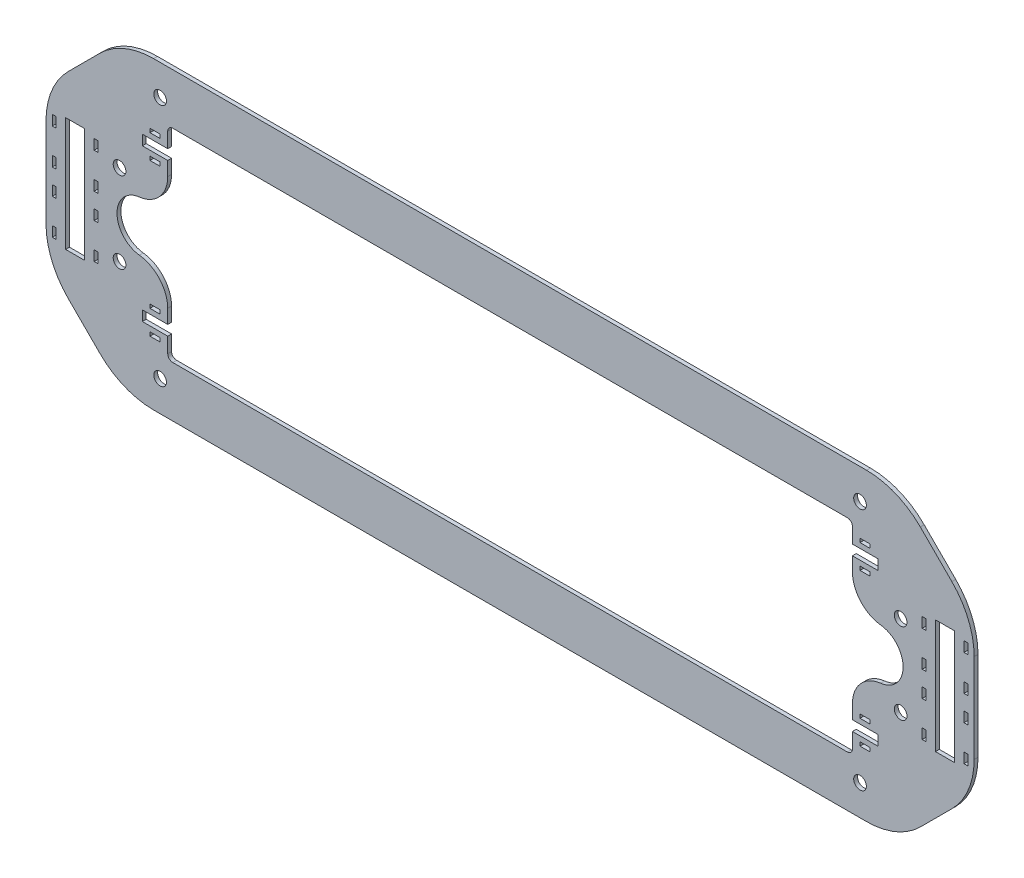
from build123d import *

# Parameters (mm, degrees)
BASE_FLANGE1_DEPTH = 1.51892
SKETCH7_R          = 2.5
SKETCH7_W          = 1.5
SKETCH7_H          = 4
SKETCH7_W_2        = 4
SKETCH7_H_2        = 1.5
CUT_EXTRUDE1_DEPTH = 10
SKETCH8_W          = 7.5
SKETCH8_H          = 45
CUT_EXTRUDE2_DEPTH = 1.51892
CUT_EXTRUDE3_START = -10
CUT_EXTRUDE3_DEPTH = 10
FILLET1_R          = 30


# Sheet-metal steps are written as plain solids
with BuildPart() as part:
    # Sketch2 → Base-Flange1 (new body)
    with BuildSketch(Plane.XY):
        with BuildLine():
            Line((183, -35), (183, 35))
            ThreePointArc((183, 35), (175.67766953, 52.67766953), (158, 60))
            Line((158, 60), (-158, 60))
            ThreePointArc((-158, 60), (-175.67766953, 52.67766953), (-183, 35))
            Line((-183, 35), (-183, -35))
            ThreePointArc((-183, -35), (-175.67766953, -52.67766953), (-158, -60))
            Line((-158, -60), (158, -60))
            ThreePointArc((158, -60), (175.67766953, -52.67766953), (183, -35))
        make_face()
        with BuildLine():
            Line((135, -28), (135, -22.5))
            ThreePointArc((135, -22.5), (138.19685081, -14.091645165), (146.172413793, -9.931034483))
            ThreePointArc((146.172413793, -9.931034483), (155, 0), (146.172413793, 9.931034483))
            ThreePointArc((146.172413793, 9.931034483), (138.19685081, 14.091645165), (135, 22.5))
            Line((135, 22.5), (135, 28))
            Line((135, 28), (145, 28))
            Line((145, 28), (145, 32))
            Line((145, 32), (135, 32))
            Line((135, 32), (135, 38))
            ThreePointArc((135, 38), (134.414213562, 39.414213562), (133, 40))
            Line((133, 40), (-133, 40))
            ThreePointArc((-133, 40), (-134.414213562, 39.414213562), (-135, 38))
            Line((-135, 38), (-135, 32))
            Line((-135, 32), (-145, 32))
            Line((-145, 32), (-145, 28))
            Line((-145, 28), (-135, 28))
            Line((-135, 28), (-135, 22.5))
            ThreePointArc((-135, 22.5), (-138.19685081, 14.091645165), (-146.172413793, 9.931034483))
            ThreePointArc((-146.172413793, 9.931034483), (-155, 0), (-146.172413793, -9.931034483))
            ThreePointArc((-146.172413793, -9.931034483), (-138.19685081, -14.091645165), (-135, -22.5))
            Line((-135, -22.5), (-135, -28))
            Line((-135, -28), (-145, -28))
            Line((-145, -28), (-145, -32))
            Line((-145, -32), (-135, -32))
            Line((-135, -32), (-135, -38))
            ThreePointArc((-135, -38), (-134.414213562, -39.414213562), (-133, -40))
            Line((-133, -40), (133, -40))
            ThreePointArc((133, -40), (134.414213562, -39.414213562), (135, -38))
            Line((135, -38), (135, -32))
            Line((135, -32), (145, -32))
            Line((145, -32), (145, -28))
            Line((145, -28), (135, -28))
        make_face(mode=Mode.SUBTRACT)
    extrude(amount=-BASE_FLANGE1_DEPTH)

    # Sketch7 → Cut-Extrude1 (cut)
    with BuildSketch(Plane.XY):
        with Locations((-154, 16)):
            Circle(SKETCH7_R)
        with Locations((-163.25, 19)):
            Rectangle(SKETCH7_W, SKETCH7_H)
        with Locations((-179.75, 19)):
            Rectangle(SKETCH7_W, SKETCH7_H)
        with Locations((-179.75, 5)):
            Rectangle(SKETCH7_W, SKETCH7_H)
        with Locations((-179.75, -5)):
            Rectangle(SKETCH7_W, SKETCH7_H)
        with Locations((-163.25, -5)):
            Rectangle(SKETCH7_W, SKETCH7_H)
        with Locations((-163.25, 5)):
            Rectangle(SKETCH7_W, SKETCH7_H)
        with Locations((-140, 25.25)):
            Rectangle(SKETCH7_W_2, SKETCH7_H_2)
        with Locations((-140, 34.75)):
            Rectangle(SKETCH7_W_2, SKETCH7_H_2)
        with Locations((-154, -16)):
            Circle(SKETCH7_R)
        with Locations((-163.25, -19)):
            Rectangle(SKETCH7_W, SKETCH7_H)
        with Locations((-179.75, -19)):
            Rectangle(SKETCH7_W, SKETCH7_H)
        with Locations((-140, -25.25)):
            Rectangle(SKETCH7_W_2, SKETCH7_H_2)
        with Locations((-140, -34.75)):
            Rectangle(SKETCH7_W_2, SKETCH7_H_2)
        with Locations((-138, -48)):
            Circle(SKETCH7_R)
        with Locations((-138, 48)):
            Circle(SKETCH7_R)
        with Locations((163.25, -19)):
            Rectangle(SKETCH7_W, SKETCH7_H)
        with Locations((154, -16)):
            Circle(SKETCH7_R)
        with Locations((140, -25.25)):
            Rectangle(SKETCH7_W_2, SKETCH7_H_2)
        with Locations((140, -34.75)):
            Rectangle(SKETCH7_W_2, SKETCH7_H_2)
        with Locations((138, -48)):
            Circle(SKETCH7_R)
        with Locations((179.75, -19)):
            Rectangle(SKETCH7_W, SKETCH7_H)
        with Locations((179.75, -5)):
            Rectangle(SKETCH7_W, SKETCH7_H)
        with Locations((163.25, -5)):
            Rectangle(SKETCH7_W, SKETCH7_H)
        with Locations((163.25, 5)):
            Rectangle(SKETCH7_W, SKETCH7_H)
        with Locations((154, 16)):
            Circle(SKETCH7_R)
        with Locations((163.25, 19)):
            Rectangle(SKETCH7_W, SKETCH7_H)
        with Locations((179.75, 19)):
            Rectangle(SKETCH7_W, SKETCH7_H)
        with Locations((179.75, 5)):
            Rectangle(SKETCH7_W, SKETCH7_H)
        with Locations((140, 25.25)):
            Rectangle(SKETCH7_W_2, SKETCH7_H_2)
        with Locations((140, 34.75)):
            Rectangle(SKETCH7_W_2, SKETCH7_H_2)
        with Locations((138, 48)):
            Circle(SKETCH7_R)
    extrude(amount=-CUT_EXTRUDE1_DEPTH, mode=Mode.SUBTRACT)

    # Sketch8 → Cut-Extrude2 (cut)
    with BuildSketch(Plane(origin=(0, 0, -1.51892), x_dir=(-1, 0, 0), z_dir=(0, 0, -1))):
        with Locations((-171.5, 0)):
            Rectangle(SKETCH8_W, SKETCH8_H)
        with Locations((171.5, 0)):
            Rectangle(SKETCH8_W, SKETCH8_H)
    extrude(amount=-CUT_EXTRUDE2_DEPTH, mode=Mode.SUBTRACT)

    # Sketch9 → Cut-Extrude3 (cut)
    with BuildSketch(Plane(origin=(0, 0, -1.51892), x_dir=(-1, 0, 0), z_dir=(0, 0, -1)).offset(CUT_EXTRUDE3_START)):
        with BuildLine():
            Line((-183, 35), (-183, 30))
            Line((-183, 30), (-153, 60))
            Line((-153, 60), (-158, 60))
            ThreePointArc((-158, 60), (-175.67766953, 52.67766953), (-183, 35))
        make_face()
        with BuildLine():
            Line((-153, -60), (-183, -30))
            Line((-183, -30), (-183, -35))
            ThreePointArc((-183, -35), (-175.67766953, -52.67766953), (-158, -60))
            Line((-158, -60), (-153, -60))
        make_face()
        with BuildLine():
            Line((183, -30), (153, -60))
            Line((153, -60), (158, -60))
            ThreePointArc((158, -60), (175.67766953, -52.67766953), (183, -35))
            Line((183, -35), (183, -30))
        make_face()
        with BuildLine():
            Line((158, 60), (153, 60))
            Line((153, 60), (183, 30))
            Line((183, 30), (183, 35))
            ThreePointArc((183, 35), (175.67766953, 52.67766953), (158, 60))
        make_face()
    extrude(amount=CUT_EXTRUDE3_DEPTH, mode=Mode.SUBTRACT)

    # Fillet1
    fillet1_edges = [part.edges().sort_by_distance(p)[0] for p in [
        (183, -30, -0.75946),
        (153, -60, -0.75946),
        (-183, -30, -0.75946),
        (-153, -60, -0.75946),
        (-183, 30, -0.75946),
        (-153, 60, -0.75946),
        (183, 30, -0.75946),
        (153, 60, -0.75946),
    ]]
    fillet(fillet1_edges, radius=FILLET1_R)


solid = part.part
